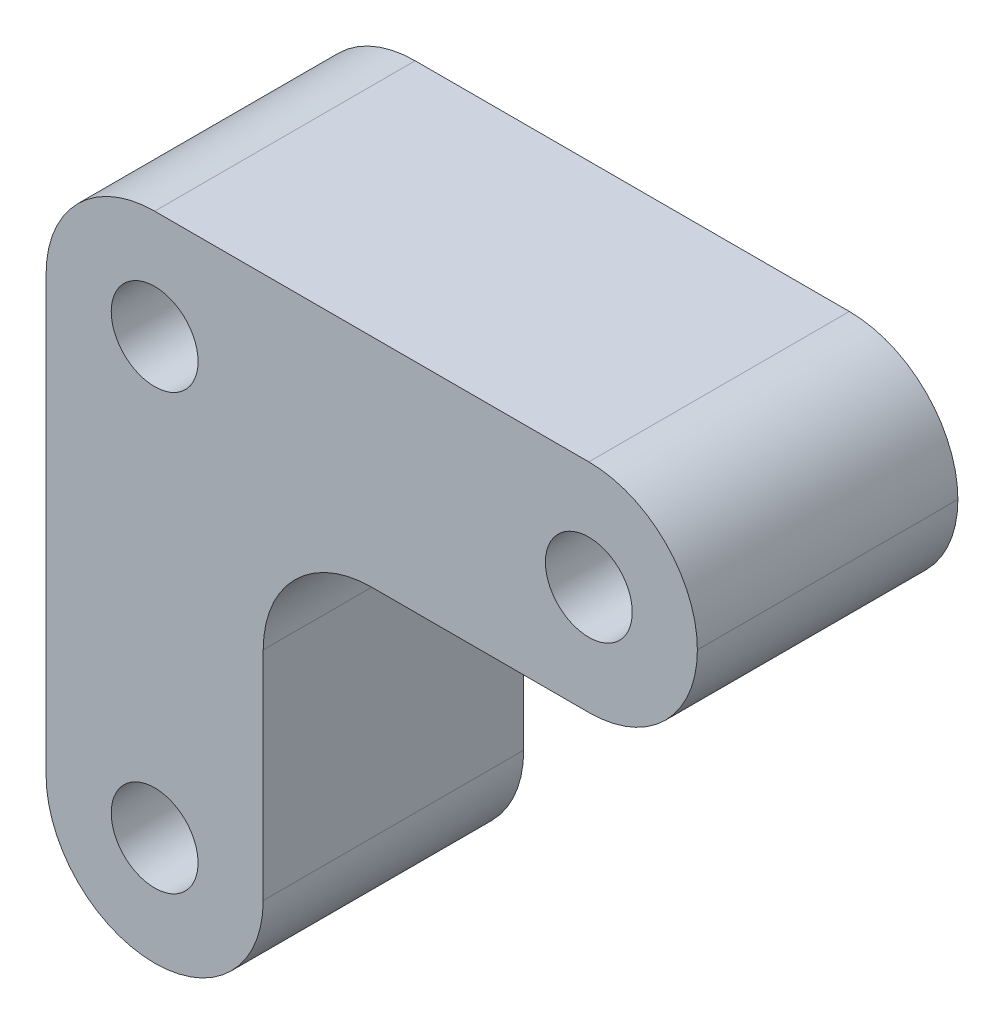
from build123d import *

# Parameters (mm, degrees)
ESQUISSE1_W                  = 30
ESQUISSE1_H                  = 30
BOSS_EXTRU_1_DEPTH           = 12
ENL_V_MAT_EXTRU_1_DEPTH      = 45.09081537
ENL_V_MAT_EXTRU_1_DEPTH_BACK = 45.09081537
ESQUISSE2_R                  = 2
ENL_V_MAT_EXTRU_2_DEPTH      = 45.09081537
ENL_V_MAT_EXTRU_2_DEPTH_BACK = 45.09081537
ESQUISSE3_W                  = 20
ESQUISSE3_H                  = 20
CONG_1_R                     = 5


with BuildPart() as part:
    # Esquisse1 → Boss.-Extru.1 (new body)
    with BuildSketch(Plane.XY):
        with Locations((15, 15)):
            Rectangle(ESQUISSE1_W, ESQUISSE1_H)
    extrude(amount=BOSS_EXTRU_1_DEPTH)

    # Esquisse2 → Enlèv. mat.-Extru.1 (cut, two sides: drawn at the far end of the back side and taken through both)
    with BuildSketch(Plane.XY.offset(12).offset(-ENL_V_MAT_EXTRU_1_DEPTH_BACK)):
        with Locations((5, 25)):
            Circle(ESQUISSE2_R)
        with Locations(Location((25, 25, 0), (0, 0, 180))):
            Circle(ESQUISSE2_R)
        with Locations((25, 5)):
            Circle(ESQUISSE2_R)
        with Locations(Location((5, 5, 0), (0, 0, 180))):
            Circle(ESQUISSE2_R)
    extrude(amount=ENL_V_MAT_EXTRU_1_DEPTH + ENL_V_MAT_EXTRU_1_DEPTH_BACK, mode=Mode.SUBTRACT)

    # Esquisse3 → Enlèv. mat.-Extru.2 (cut, two sides: drawn at the far end of the back side and taken through both)
    with BuildSketch(Plane.XY.offset(12).offset(-ENL_V_MAT_EXTRU_2_DEPTH_BACK)):
        with Locations((20, 10)):
            Rectangle(ESQUISSE3_W, ESQUISSE3_H)
    extrude(amount=ENL_V_MAT_EXTRU_2_DEPTH + ENL_V_MAT_EXTRU_2_DEPTH_BACK, mode=Mode.SUBTRACT)

    # Congé1
    cong_1_edges = [part.edges().sort_by_distance(p)[0] for p in [
        (10, 20, 6),
        (0, 30, 6),
        (0, 0, 6),
        (10, 0, 6),
        (30, 30, 6),
        (30, 20, 6),
    ]]
    fillet(cong_1_edges, radius=CONG_1_R - 0.0001)  # a hair under: the kernel refuses the full size


solid = part.part
